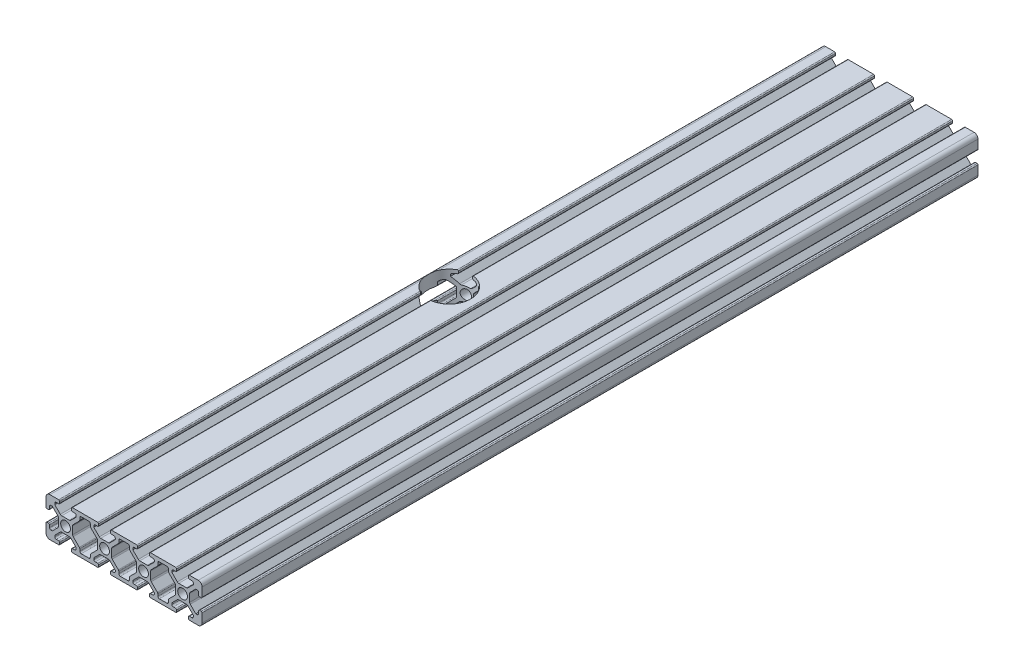
from build123d import *

# Parameters (mm, degrees)
SKETCH1_R           = 2.5
BOSS_EXTRUDE1_DEPTH = 397.66
SKETCH2_R           = 11
CUT_EXTRUDE6_DEPTH  = 20


with BuildPart() as part:
    # Sketch1 → Boss-Extrude1 (new body)
    with BuildSketch(Plane.XY):
        with BuildLine():
            Line((-33.804166707, -5.262943071), (-29.304166707, -5.262943071))
            ThreePointArc((-29.304166707, -5.262943071), (-28.950613317, -5.116496461), (-28.804166707, -4.762943071))
            Line((-28.804166707, -4.762943071), (-28.804166707, -3.962943071))
            ThreePointArc((-28.804166707, -3.962943071), (-28.950613317, -3.60938968), (-29.304166707, -3.462943071))
            Line((-29.304166707, -3.462943071), (-30.554166707, -3.462943071))
            ThreePointArc((-30.554166707, -3.462943071), (-31.084496793, -3.243273157), (-31.304166707, -2.712943071))
            Line((-31.304166707, -2.712943071), (-31.304166707, -2.035735277))
            Line((-31.304166707, -2.035735277), (-28.47426772, 0.794163711))
            ThreePointArc((-28.47426772, 0.794163711), (-28.149844371, 1.010936462), (-27.767160939, 1.087056929))
            Line((-27.767160939, 1.087056929), (-23.841172476, 1.087056929))
            ThreePointArc((-23.841172476, 1.087056929), (-23.458489043, 1.010936462), (-23.134065694, 0.794163711))
            Line((-23.134065694, 0.794163711), (-20.304166707, -2.035735277))
            Line((-20.304166707, -2.035735277), (-20.304166707, -2.712943071))
            ThreePointArc((-20.304166707, -2.712943071), (-20.523836621, -3.243273157), (-21.054166707, -3.462943071))
            Line((-21.054166707, -3.462943071), (-22.304166707, -3.462943071))
            ThreePointArc((-22.304166707, -3.462943071), (-22.657720098, -3.60938968), (-22.804166707, -3.962943071))
            Line((-22.804166707, -3.962943071), (-22.804166707, -4.762943071))
            ThreePointArc((-22.804166707, -4.762943071), (-22.657720098, -5.116496461), (-22.304166707, -5.262943071))
            Line((-22.304166707, -5.262943071), (-9.304166707, -5.262943071))
            ThreePointArc((-9.304166707, -5.262943071), (-8.950613317, -5.116496461), (-8.804166707, -4.762943071))
            Line((-8.804166707, -4.762943071), (-8.804166707, -3.962943071))
            ThreePointArc((-8.804166707, -3.962943071), (-8.950613317, -3.60938968), (-9.304166707, -3.462943071))
            Line((-9.304166707, -3.462943071), (-10.554166707, -3.462943071))
            ThreePointArc((-10.554166707, -3.462943071), (-11.084496793, -3.243273157), (-11.304166707, -2.712943071))
            Line((-11.304166707, -2.712943071), (-11.304166707, -2.035735277))
            Line((-11.304166707, -2.035735277), (-8.47426772, 0.794163711))
            ThreePointArc((-8.47426772, 0.794163711), (-8.149844371, 1.010936462), (-7.767160939, 1.087056929))
            Line((-7.767160939, 1.087056929), (-3.841172476, 1.087056929))
            ThreePointArc((-3.841172476, 1.087056929), (-3.458489043, 1.010936462), (-3.134065694, 0.794163711))
            Line((-3.134065694, 0.794163711), (-0.304166707, -2.035735277))
            Line((-0.304166707, -2.035735277), (-0.304166707, -2.712943071))
            ThreePointArc((-0.304166707, -2.712943071), (-0.523836621, -3.243273157), (-1.054166707, -3.462943071))
            Line((-1.054166707, -3.462943071), (-2.304166707, -3.462943071))
            ThreePointArc((-2.304166707, -3.462943071), (-2.657720098, -3.60938968), (-2.804166707, -3.962943071))
            Line((-2.804166707, -3.962943071), (-2.804166707, -4.762943071))
            ThreePointArc((-2.804166707, -4.762943071), (-2.657720098, -5.116496461), (-2.304166707, -5.262943071))
            Line((-2.304166707, -5.262943071), (10.695833293, -5.262943071))
            ThreePointArc((10.695833293, -5.262943071), (11.049386683, -5.116496461), (11.195833293, -4.762943071))
            Line((11.195833293, -4.762943071), (11.195833293, -3.962943071))
            ThreePointArc((11.195833293, -3.962943071), (11.049386683, -3.60938968), (10.695833293, -3.462943071))
            Line((10.695833293, -3.462943071), (9.445833293, -3.462943071))
            ThreePointArc((9.445833293, -3.462943071), (8.915503207, -3.243273157), (8.695833293, -2.712943071))
            Line((8.695833293, -2.712943071), (8.695833293, -2.035735277))
            Line((8.695833293, -2.035735277), (11.52573228, 0.794163711))
            ThreePointArc((11.52573228, 0.794163711), (11.850155629, 1.010936462), (12.232839061, 1.087056929))
            Line((12.232839061, 1.087056929), (16.158827524, 1.087056929))
            ThreePointArc((16.158827524, 1.087056929), (16.541510957, 1.010936462), (16.865934306, 0.794163711))
            Line((16.865934306, 0.794163711), (19.695833293, -2.035735277))
            Line((19.695833293, -2.035735277), (19.695833293, -2.712943071))
            ThreePointArc((19.695833293, -2.712943071), (19.476163379, -3.243273157), (18.945833293, -3.462943071))
            Line((18.945833293, -3.462943071), (17.695833293, -3.462943071))
            ThreePointArc((17.695833293, -3.462943071), (17.342279902, -3.60938968), (17.195833293, -3.962943071))
            Line((17.195833293, -3.962943071), (17.195833293, -4.762943071))
            ThreePointArc((17.195833293, -4.762943071), (17.342279902, -5.116496461), (17.695833293, -5.262943071))
            Line((17.695833293, -5.262943071), (30.695833293, -5.262943071))
            ThreePointArc((30.695833293, -5.262943071), (31.049386683, -5.116496461), (31.195833293, -4.762943071))
            Line((31.195833293, -4.762943071), (31.195833293, -3.962943071))
            ThreePointArc((31.195833293, -3.962943071), (31.049386683, -3.60938968), (30.695833293, -3.462943071))
            Line((30.695833293, -3.462943071), (29.445833293, -3.462943071))
            ThreePointArc((29.445833293, -3.462943071), (28.915503207, -3.243273157), (28.695833293, -2.712943071))
            Line((28.695833293, -2.712943071), (28.695833293, -2.035735277))
            Line((28.695833293, -2.035735277), (31.52573228, 0.794163711))
            ThreePointArc((31.52573228, 0.794163711), (31.850155629, 1.010936462), (32.232839061, 1.087056929))
            Line((32.232839061, 1.087056929), (36.158827524, 1.087056929))
            ThreePointArc((36.158827524, 1.087056929), (36.541510957, 1.010936462), (36.865934306, 0.794163711))
            Line((36.865934306, 0.794163711), (39.695833293, -2.035735277))
            Line((39.695833293, -2.035735277), (39.695833293, -2.712943071))
            ThreePointArc((39.695833293, -2.712943071), (39.476163379, -3.243273157), (38.945833293, -3.462943071))
            Line((38.945833293, -3.462943071), (37.695833293, -3.462943071))
            ThreePointArc((37.695833293, -3.462943071), (37.342279902, -3.60938968), (37.195833293, -3.962943071))
            Line((37.195833293, -3.962943071), (37.195833293, -4.762943071))
            ThreePointArc((37.195833293, -4.762943071), (37.342279902, -5.116496461), (37.695833293, -5.262943071))
            Line((37.695833293, -5.262943071), (42.195833293, -5.262943071))
            ThreePointArc((42.195833293, -5.262943071), (43.610046855, -4.677156633), (44.195833293, -3.262943071))
            Line((44.195833293, -3.262943071), (44.195833293, 1.237056929))
            ThreePointArc((44.195833293, 1.237056929), (44.049386683, 1.59061032), (43.695833293, 1.737056929))
            Line((43.695833293, 1.737056929), (42.895833293, 1.737056929))
            ThreePointArc((42.895833293, 1.737056929), (42.542279902, 1.59061032), (42.395833293, 1.237056929))
            Line((42.395833293, 1.237056929), (42.395833293, -0.012943071))
            ThreePointArc((42.395833293, -0.012943071), (42.176163379, -0.543273157), (41.645833293, -0.762943071))
            Line((41.645833293, -0.762943071), (40.968625499, -0.762943071))
            Line((40.968625499, -0.762943071), (38.138726512, 2.066955917))
            ThreePointArc((38.138726512, 2.066955917), (37.92195376, 2.391379266), (37.845833293, 2.774062698))
            Line((37.845833293, 2.774062698), (37.845833293, 6.700051161))
            ThreePointArc((37.845833293, 6.700051161), (37.92195376, 7.082734593), (38.138726512, 7.407157942))
            Line((38.138726512, 7.407157942), (40.968625499, 10.237056929))
            Line((40.968625499, 10.237056929), (41.645833293, 10.237056929))
            ThreePointArc((41.645833293, 10.237056929), (42.176163379, 10.017387015), (42.395833293, 9.487056929))
            Line((42.395833293, 9.487056929), (42.395833293, 8.237056929))
            ThreePointArc((42.395833293, 8.237056929), (42.542279902, 7.883503539), (42.895833293, 7.737056929))
            Line((42.895833293, 7.737056929), (43.695833293, 7.737056929))
            ThreePointArc((43.695833293, 7.737056929), (44.049386683, 7.883503539), (44.195833293, 8.237056929))
            Line((44.195833293, 8.237056929), (44.195833293, 12.737056929))
            ThreePointArc((44.195833293, 12.737056929), (43.610046855, 14.151270492), (42.195833293, 14.737056929))
            Line((42.195833293, 14.737056929), (37.695833293, 14.737056929))
            ThreePointArc((37.695833293, 14.737056929), (37.342279902, 14.59061032), (37.195833293, 14.237056929))
            Line((37.195833293, 14.237056929), (37.195833293, 13.437056929))
            ThreePointArc((37.195833293, 13.437056929), (37.342279902, 13.083503539), (37.695833293, 12.937056929))
            Line((37.695833293, 12.937056929), (38.945833293, 12.937056929))
            ThreePointArc((38.945833293, 12.937056929), (39.476163379, 12.717387015), (39.695833293, 12.187056929))
            Line((39.695833293, 12.187056929), (39.695833293, 11.509849136))
            Line((39.695833293, 11.509849136), (36.865934306, 8.679950148))
            ThreePointArc((36.865934306, 8.679950148), (36.541510957, 8.463177397), (36.158827524, 8.387056929))
            Line((36.158827524, 8.387056929), (32.232839061, 8.387056929))
            ThreePointArc((32.232839061, 8.387056929), (31.850155629, 8.463177397), (31.52573228, 8.679950148))
            Line((31.52573228, 8.679950148), (28.695833293, 11.509849136))
            Line((28.695833293, 11.509849136), (28.695833293, 12.187056929))
            ThreePointArc((28.695833293, 12.187056929), (28.915503207, 12.717387015), (29.445833293, 12.937056929))
            Line((29.445833293, 12.937056929), (30.695833293, 12.937056929))
            ThreePointArc((30.695833293, 12.937056929), (31.049386683, 13.083503539), (31.195833293, 13.437056929))
            Line((31.195833293, 13.437056929), (31.195833293, 14.237056929))
            ThreePointArc((31.195833293, 14.237056929), (31.049386683, 14.59061032), (30.695833293, 14.737056929))
            Line((30.695833293, 14.737056929), (17.695833293, 14.737056929))
            ThreePointArc((17.695833293, 14.737056929), (17.342279902, 14.59061032), (17.195833293, 14.237056929))
            Line((17.195833293, 14.237056929), (17.195833293, 13.437056929))
            ThreePointArc((17.195833293, 13.437056929), (17.342279902, 13.083503539), (17.695833293, 12.937056929))
            Line((17.695833293, 12.937056929), (18.945833293, 12.937056929))
            ThreePointArc((18.945833293, 12.937056929), (19.476163379, 12.717387015), (19.695833293, 12.187056929))
            Line((19.695833293, 12.187056929), (19.695833293, 11.509849136))
            Line((19.695833293, 11.509849136), (16.865934306, 8.679950148))
            ThreePointArc((16.865934306, 8.679950148), (16.541510957, 8.463177397), (16.158827524, 8.387056929))
            Line((16.158827524, 8.387056929), (12.232839061, 8.387056929))
            ThreePointArc((12.232839061, 8.387056929), (11.850155629, 8.463177397), (11.52573228, 8.679950148))
            Line((11.52573228, 8.679950148), (8.695833293, 11.509849136))
            Line((8.695833293, 11.509849136), (8.695833293, 12.187056929))
            ThreePointArc((8.695833293, 12.187056929), (8.915503207, 12.717387015), (9.445833293, 12.937056929))
            Line((9.445833293, 12.937056929), (10.695833293, 12.937056929))
            ThreePointArc((10.695833293, 12.937056929), (11.049386683, 13.083503539), (11.195833293, 13.437056929))
            Line((11.195833293, 13.437056929), (11.195833293, 14.237056929))
            ThreePointArc((11.195833293, 14.237056929), (11.049386683, 14.59061032), (10.695833293, 14.737056929))
            Line((10.695833293, 14.737056929), (-2.304166707, 14.737056929))
            ThreePointArc((-2.304166707, 14.737056929), (-2.657720098, 14.59061032), (-2.804166707, 14.237056929))
            Line((-2.804166707, 14.237056929), (-2.804166707, 13.437056929))
            ThreePointArc((-2.804166707, 13.437056929), (-2.657720098, 13.083503539), (-2.304166707, 12.937056929))
            Line((-2.304166707, 12.937056929), (-1.054166707, 12.937056929))
            ThreePointArc((-1.054166707, 12.937056929), (-0.523836621, 12.717387015), (-0.304166707, 12.187056929))
            Line((-0.304166707, 12.187056929), (-0.304166707, 11.509849136))
            Line((-0.304166707, 11.509849136), (-3.134065694, 8.679950148))
            ThreePointArc((-3.134065694, 8.679950148), (-3.458489043, 8.463177397), (-3.841172476, 8.387056929))
            Line((-3.841172476, 8.387056929), (-7.767160939, 8.387056929))
            ThreePointArc((-7.767160939, 8.387056929), (-8.149844371, 8.463177397), (-8.47426772, 8.679950148))
            Line((-8.47426772, 8.679950148), (-11.304166707, 11.509849136))
            Line((-11.304166707, 11.509849136), (-11.304166707, 12.187056929))
            ThreePointArc((-11.304166707, 12.187056929), (-11.084496793, 12.717387015), (-10.554166707, 12.937056929))
            Line((-10.554166707, 12.937056929), (-9.304166707, 12.937056929))
            ThreePointArc((-9.304166707, 12.937056929), (-8.950613317, 13.083503539), (-8.804166707, 13.437056929))
            Line((-8.804166707, 13.437056929), (-8.804166707, 14.237056929))
            ThreePointArc((-8.804166707, 14.237056929), (-8.950613317, 14.59061032), (-9.304166707, 14.737056929))
            Line((-9.304166707, 14.737056929), (-22.304166707, 14.737056929))
            ThreePointArc((-22.304166707, 14.737056929), (-22.657720098, 14.59061032), (-22.804166707, 14.237056929))
            Line((-22.804166707, 14.237056929), (-22.804166707, 13.437056929))
            ThreePointArc((-22.804166707, 13.437056929), (-22.657720098, 13.083503539), (-22.304166707, 12.937056929))
            Line((-22.304166707, 12.937056929), (-21.054166707, 12.937056929))
            ThreePointArc((-21.054166707, 12.937056929), (-20.523836621, 12.717387015), (-20.304166707, 12.187056929))
            Line((-20.304166707, 12.187056929), (-20.304166707, 11.509849136))
            Line((-20.304166707, 11.509849136), (-23.134065694, 8.679950148))
            ThreePointArc((-23.134065694, 8.679950148), (-23.458489043, 8.463177397), (-23.841172476, 8.387056929))
            Line((-23.841172476, 8.387056929), (-27.767160939, 8.387056929))
            ThreePointArc((-27.767160939, 8.387056929), (-28.149844371, 8.463177397), (-28.47426772, 8.679950148))
            Line((-28.47426772, 8.679950148), (-31.304166707, 11.509849136))
            Line((-31.304166707, 11.509849136), (-31.304166707, 12.187056929))
            ThreePointArc((-31.304166707, 12.187056929), (-31.084496793, 12.717387015), (-30.554166707, 12.937056929))
            Line((-30.554166707, 12.937056929), (-29.304166707, 12.937056929))
            ThreePointArc((-29.304166707, 12.937056929), (-28.950613317, 13.083503539), (-28.804166707, 13.437056929))
            Line((-28.804166707, 13.437056929), (-28.804166707, 14.237056929))
            ThreePointArc((-28.804166707, 14.237056929), (-28.950613317, 14.59061032), (-29.304166707, 14.737056929))
            Line((-29.304166707, 14.737056929), (-33.804166707, 14.737056929))
            ThreePointArc((-33.804166707, 14.737056929), (-35.218380269, 14.151270492), (-35.804166707, 12.737056929))
            Line((-35.804166707, 12.737056929), (-35.804166707, 8.237056929))
            ThreePointArc((-35.804166707, 8.237056929), (-35.657720098, 7.883503539), (-35.304166707, 7.737056929))
            Line((-35.304166707, 7.737056929), (-34.504166707, 7.737056929))
            ThreePointArc((-34.504166707, 7.737056929), (-34.150613317, 7.883503539), (-34.004166707, 8.237056929))
            Line((-34.004166707, 8.237056929), (-34.004166707, 9.487056929))
            ThreePointArc((-34.004166707, 9.487056929), (-33.784496793, 10.017387015), (-33.254166707, 10.237056929))
            Line((-33.254166707, 10.237056929), (-32.576958913, 10.237056929))
            Line((-32.576958913, 10.237056929), (-29.747059926, 7.407157942))
            ThreePointArc((-29.747059926, 7.407157942), (-29.530287175, 7.082734593), (-29.454166707, 6.700051161))
            Line((-29.454166707, 6.700051161), (-29.454166707, 2.774062698))
            ThreePointArc((-29.454166707, 2.774062698), (-29.530287175, 2.391379266), (-29.747059926, 2.066955917))
            Line((-29.747059926, 2.066955917), (-32.576958913, -0.762943071))
            Line((-32.576958913, -0.762943071), (-33.254166707, -0.762943071))
            ThreePointArc((-33.254166707, -0.762943071), (-33.784496793, -0.543273157), (-34.004166707, -0.012943071))
            Line((-34.004166707, -0.012943071), (-34.004166707, 1.237056929))
            ThreePointArc((-34.004166707, 1.237056929), (-34.150613317, 1.59061032), (-34.504166707, 1.737056929))
            Line((-34.504166707, 1.737056929), (-35.304166707, 1.737056929))
            ThreePointArc((-35.304166707, 1.737056929), (-35.657720098, 1.59061032), (-35.804166707, 1.237056929))
            Line((-35.804166707, 1.237056929), (-35.804166707, -3.262943071))
            ThreePointArc((-35.804166707, -3.262943071), (-35.218380269, -4.677156633), (-33.804166707, -5.262943071))
        make_face()
        with Locations((-25.804166707, 4.737056929)):
            Circle(SKETCH1_R, mode=Mode.SUBTRACT)
        with Locations((-5.804166707, 4.737056929)):
            Circle(SKETCH1_R, mode=Mode.SUBTRACT)
        with Locations((14.195833293, 4.737056929)):
            Circle(SKETCH1_R, mode=Mode.SUBTRACT)
        with Locations((34.195833293, 4.737056929)):
            Circle(SKETCH1_R, mode=Mode.SUBTRACT)
        with BuildLine():
            Line((-1.861273488, 7.407157942), (1.276163379, 10.544594809))
            ThreePointArc((1.276163379, 10.544594809), (1.438742942, 10.787912321), (1.495833293, 11.074924895))
            Line((1.495833293, 11.074924895), (1.495833293, 12.187056929))
            ThreePointArc((1.495833293, 12.187056929), (1.715503207, 12.717387015), (2.245833293, 12.937056929))
            Line((2.245833293, 12.937056929), (6.145833293, 12.937056929))
            ThreePointArc((6.145833293, 12.937056929), (6.676163379, 12.717387015), (6.895833293, 12.187056929))
            Line((6.895833293, 12.187056929), (6.895833293, 11.074924895))
            ThreePointArc((6.895833293, 11.074924895), (6.952923644, 10.787912321), (7.115503207, 10.544594809))
            Line((7.115503207, 10.544594809), (10.252940074, 7.407157942))
            ThreePointArc((10.252940074, 7.407157942), (10.469712825, 7.082734593), (10.545833293, 6.700051161))
            Line((10.545833293, 6.700051161), (10.545833293, 2.774062698))
            ThreePointArc((10.545833293, 2.774062698), (10.469712825, 2.391379266), (10.252940074, 2.066955917))
            Line((10.252940074, 2.066955917), (7.115503207, -1.07048095))
            ThreePointArc((7.115503207, -1.07048095), (6.952923644, -1.313798462), (6.895833293, -1.600811036))
            Line((6.895833293, -1.600811036), (6.895833293, -2.712943071))
            ThreePointArc((6.895833293, -2.712943071), (6.676163379, -3.243273157), (6.145833293, -3.462943071))
            Line((6.145833293, -3.462943071), (2.245833293, -3.462943071))
            ThreePointArc((2.245833293, -3.462943071), (1.715503207, -3.243273157), (1.495833293, -2.712943071))
            Line((1.495833293, -2.712943071), (1.495833293, -1.600811036))
            ThreePointArc((1.495833293, -1.600811036), (1.438742942, -1.313798462), (1.276163379, -1.07048095))
            Line((1.276163379, -1.07048095), (-1.861273488, 2.066955917))
            ThreePointArc((-1.861273488, 2.066955917), (-2.07804624, 2.391379266), (-2.154166707, 2.774062698))
            Line((-2.154166707, 2.774062698), (-2.154166707, 6.700051161))
            ThreePointArc((-2.154166707, 6.700051161), (-2.07804624, 7.082734593), (-1.861273488, 7.407157942))
        make_face(mode=Mode.SUBTRACT)
        with BuildLine():
            Line((-12.884496793, 10.544594809), (-9.747059926, 7.407157942))
            ThreePointArc((-9.747059926, 7.407157942), (-9.530287175, 7.082734593), (-9.454166707, 6.700051161))
            Line((-9.454166707, 6.700051161), (-9.454166707, 2.774062698))
            ThreePointArc((-9.454166707, 2.774062698), (-9.530287175, 2.391379266), (-9.747059926, 2.066955917))
            Line((-9.747059926, 2.066955917), (-12.884496793, -1.07048095))
            ThreePointArc((-12.884496793, -1.07048095), (-13.047076356, -1.313798462), (-13.104166707, -1.600811036))
            Line((-13.104166707, -1.600811036), (-13.104166707, -2.712943071))
            ThreePointArc((-13.104166707, -2.712943071), (-13.323836621, -3.243273157), (-13.854166707, -3.462943071))
            Line((-13.854166707, -3.462943071), (-17.754166707, -3.462943071))
            ThreePointArc((-17.754166707, -3.462943071), (-18.284496793, -3.243273157), (-18.504166707, -2.712943071))
            Line((-18.504166707, -2.712943071), (-18.504166707, -1.600811036))
            ThreePointArc((-18.504166707, -1.600811036), (-18.561257058, -1.313798462), (-18.723836621, -1.07048095))
            Line((-18.723836621, -1.07048095), (-21.861273488, 2.066955917))
            ThreePointArc((-21.861273488, 2.066955917), (-22.07804624, 2.391379266), (-22.154166707, 2.774062698))
            Line((-22.154166707, 2.774062698), (-22.154166707, 6.700051161))
            ThreePointArc((-22.154166707, 6.700051161), (-22.07804624, 7.082734593), (-21.861273488, 7.407157942))
            Line((-21.861273488, 7.407157942), (-18.723836621, 10.544594809))
            ThreePointArc((-18.723836621, 10.544594809), (-18.561257058, 10.787912321), (-18.504166707, 11.074924895))
            Line((-18.504166707, 11.074924895), (-18.504166707, 12.187056929))
            ThreePointArc((-18.504166707, 12.187056929), (-18.284496793, 12.717387015), (-17.754166707, 12.937056929))
            Line((-17.754166707, 12.937056929), (-13.854166707, 12.937056929))
            ThreePointArc((-13.854166707, 12.937056929), (-13.323836621, 12.717387015), (-13.104166707, 12.187056929))
            Line((-13.104166707, 12.187056929), (-13.104166707, 11.074924895))
            ThreePointArc((-13.104166707, 11.074924895), (-13.047076356, 10.787912321), (-12.884496793, 10.544594809))
        make_face(mode=Mode.SUBTRACT)
        with BuildLine():
            Line((27.115503207, 10.544594809), (30.252940074, 7.407157942))
            ThreePointArc((30.252940074, 7.407157942), (30.469712825, 7.082734593), (30.545833293, 6.700051161))
            Line((30.545833293, 6.700051161), (30.545833293, 2.774062698))
            ThreePointArc((30.545833293, 2.774062698), (30.469712825, 2.391379266), (30.252940074, 2.066955917))
            Line((30.252940074, 2.066955917), (27.115503207, -1.07048095))
            ThreePointArc((27.115503207, -1.07048095), (26.952923644, -1.313798462), (26.895833293, -1.600811036))
            Line((26.895833293, -1.600811036), (26.895833293, -2.712943071))
            ThreePointArc((26.895833293, -2.712943071), (26.676163379, -3.243273157), (26.145833293, -3.462943071))
            Line((26.145833293, -3.462943071), (22.245833293, -3.462943071))
            ThreePointArc((22.245833293, -3.462943071), (21.715503207, -3.243273157), (21.495833293, -2.712943071))
            Line((21.495833293, -2.712943071), (21.495833293, -1.600811036))
            ThreePointArc((21.495833293, -1.600811036), (21.438742942, -1.313798462), (21.276163379, -1.07048095))
            Line((21.276163379, -1.07048095), (18.138726512, 2.066955917))
            ThreePointArc((18.138726512, 2.066955917), (17.92195376, 2.391379266), (17.845833293, 2.774062698))
            Line((17.845833293, 2.774062698), (17.845833293, 6.700051161))
            ThreePointArc((17.845833293, 6.700051161), (17.92195376, 7.082734593), (18.138726512, 7.407157942))
            Line((18.138726512, 7.407157942), (21.276163379, 10.544594809))
            ThreePointArc((21.276163379, 10.544594809), (21.438742942, 10.787912321), (21.495833293, 11.074924895))
            Line((21.495833293, 11.074924895), (21.495833293, 12.187056929))
            ThreePointArc((21.495833293, 12.187056929), (21.715503207, 12.717387015), (22.245833293, 12.937056929))
            Line((22.245833293, 12.937056929), (26.145833293, 12.937056929))
            ThreePointArc((26.145833293, 12.937056929), (26.676163379, 12.717387015), (26.895833293, 12.187056929))
            Line((26.895833293, 12.187056929), (26.895833293, 11.074924895))
            ThreePointArc((26.895833293, 11.074924895), (26.952923644, 10.787912321), (27.115503207, 10.544594809))
        make_face(mode=Mode.SUBTRACT)
    extrude(amount=BOSS_EXTRUDE1_DEPTH)

    # Sketch2 → Cut-Extrude6 (cut)
    with BuildSketch(Plane(origin=(0, 14.737056929, 0), x_dir=(1, 0, 0), z_dir=(0, 1, 0))):
        with Locations((-23.804166707, -202.996943992)):
            Circle(SKETCH2_R)
    extrude(amount=-CUT_EXTRUDE6_DEPTH, mode=Mode.SUBTRACT)


solid = part.part
